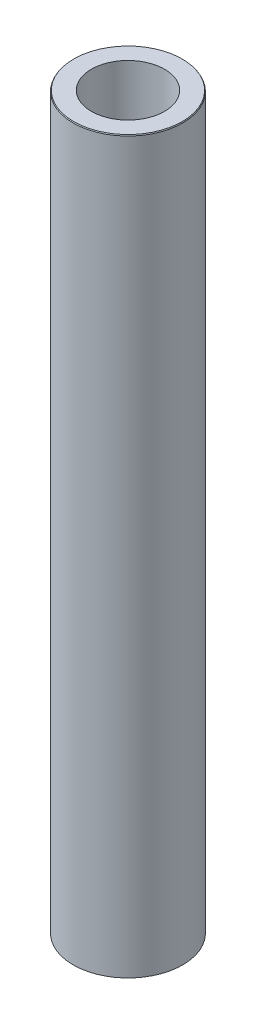
from build123d import *
from OCP.BRepFilletAPI import BRepFilletAPI_MakeChamfer

# Parameters (mm, degrees)
SKETCH1_R           = 45
BOSS_EXTRUDE1_DEPTH = 600
SKETCH2_R           = 30.027428977
CUT_EXTRUDE1_DEPTH  = 604.365560834
CHAMFER1_SIZE       = 0.74164576
CHAMFER1_SIZE2      = 0.45882672


with BuildPart() as part:
    # Sketch1 → Boss-Extrude1 (new body)
    with BuildSketch(Plane(origin=(0, 0, 0), x_dir=(1, 0, 0), z_dir=(0, 1, 0))):
        Circle(SKETCH1_R)
    extrude(amount=BOSS_EXTRUDE1_DEPTH)

    # Sketch2 → Cut-Extrude1 (cut, through all)
    with BuildSketch(Plane(origin=(0, 0, 0), x_dir=(1, 0, 0), z_dir=(0, 1, 0))):
        Circle(SKETCH2_R)
    extrude(amount=CUT_EXTRUDE1_DEPTH, mode=Mode.SUBTRACT)

    # Chamfer1: one chamfer whose edges measure the first distance from different faces: ONE call of the kernel's chamfer builder (chamfer() names one face for all edges)
    chamfer1_edges_1 = [part.edges().sort_by_distance(p)[0] for p in [
        (-45, 600, 0),
    ]]
    chamfer1_side_1 = [part.faces().sort_by_distance(p)[0] for p in [
        (-45, 300, 0),
    ]]
    chamfer1_edges_2 = [part.edges().sort_by_distance(p)[0] for p in [
        (-45, 0, 0),
    ]]
    chamfer1_side_2 = [part.faces().sort_by_distance(p)[0] for p in [
        (-43.727207794, 0, 0),
    ]]
    chamfer1 = BRepFilletAPI_MakeChamfer(part.part.solid().wrapped)
    for e in chamfer1_edges_1:
        chamfer1.Add(CHAMFER1_SIZE, CHAMFER1_SIZE2, e.wrapped, chamfer1_side_1[0].wrapped)  # the first distance lies on this face
    for e in chamfer1_edges_2:
        chamfer1.Add(CHAMFER1_SIZE, CHAMFER1_SIZE2, e.wrapped, chamfer1_side_2[0].wrapped)  # the first distance lies on this face
    add(Compound.cast(chamfer1.Shape()), mode=Mode.REPLACE)


solid = part.part
